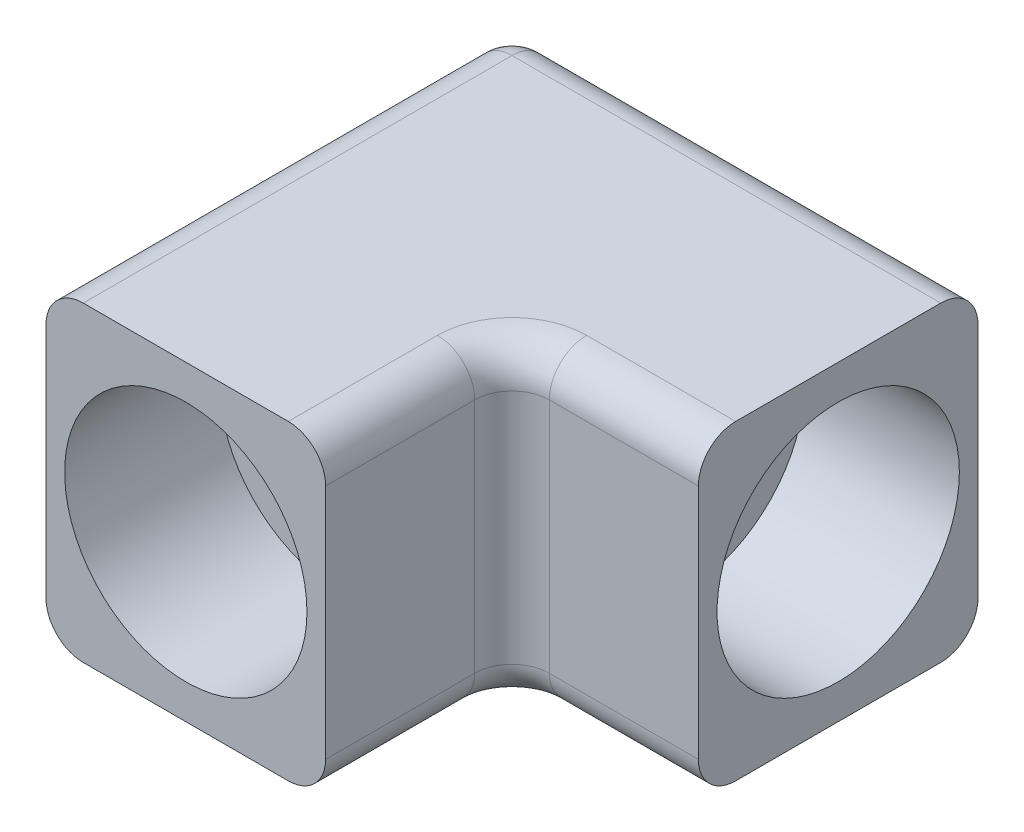
from build123d import *

# Parameters (mm, degrees)
SKETCH1_W           = 15
SKETCH1_H           = 10
SKETCH1_H_2         = 15
SKETCH1_W_2         = 10
BOSS_EXTRUDE1_DEPTH = 16.7
SKETCH2_R           = 6.5
CUT_EXTRUDE1_DEPTH  = 8.3
SKETCH3_R           = 6.5
CUT_EXTRUDE2_DEPTH  = 8.3
SKETCH4_R           = 6.5
CUT_EXTRUDE3_DEPTH  = 14.7
FILLET8_R           = 2


with BuildPart() as part:
    # Sketch1 → Boss-Extrude1 (new body)
    with BuildSketch(Plane(origin=(0, 0, 0), x_dir=(1, 0, 0), z_dir=(0, 1, 0))):
        Rectangle(SKETCH1_W, SKETCH1_H)
        with Locations((0, 12.5)):
            Rectangle(SKETCH1_W, SKETCH1_H_2)
        with Locations((12.5, 12.5)):
            Rectangle(SKETCH1_W_2, SKETCH1_H_2)
    extrude(amount=BOSS_EXTRUDE1_DEPTH)

    # Sketch2 → Cut-Extrude1 (cut)
    with BuildSketch(Plane.XY.offset(5)):
        with Locations((0, 8.35)):
            Circle(SKETCH2_R)
    extrude(amount=-CUT_EXTRUDE1_DEPTH, mode=Mode.SUBTRACT)

    # Sketch3 → Cut-Extrude2 (cut)
    with BuildSketch(Plane(origin=(17.5, 0, 0), x_dir=(0, 0, -1), z_dir=(1, 0, 0))):
        with Locations((12.5, 8.35)):
            Circle(SKETCH3_R)
    extrude(amount=-CUT_EXTRUDE2_DEPTH, mode=Mode.SUBTRACT)

    # Sketch4 → Cut-Extrude3 (cut)
    with BuildSketch(Plane.XZ):
        with Locations(Location((0, -12.5, 0), (0, 0, 270))):
            Circle(SKETCH4_R)
    extrude(amount=-CUT_EXTRUDE3_DEPTH, mode=Mode.SUBTRACT)

    # Fillet8
    # the kernel refuses this fillet: 2 mm, written as the material it adds along each edge
    with BuildSketch(Plane(origin=(7.5, 0, -5), x_dir=(0, 0, 1), z_dir=(0, 1, 0))) as fillet8_piece_1:
        with BuildLine():
            CenterArc((FILLET8_R, FILLET8_R), FILLET8_R, 180, 90)
            Line((0, FILLET8_R), (0, 0))
            Line((0, 0), (FILLET8_R, 0))
        make_face()
    extrude(amount=16.7)
    # the kernel refuses this fillet: 2 mm, written as the material it takes off along each edge
    with BuildSketch(Plane(origin=(-5.5, 2, -18), x_dir=(0, 0, -1), z_dir=(-1, 0, 0))) as fillet8_2_piece_1_section:
        Polygon((0, 0), (FILLET8_R, 0), (FILLET8_R, FILLET8_R), (0, FILLET8_R), align=None)
    fillet8_2_piece_1 = extrude(amount=FILLET8_R, mode=Mode.PRIVATE)
    fillet8_2_piece_1 = fillet8_2_piece_1 - Plane(origin=(-5.5, 2, -18), x_dir=(0, 0.7071067811865475, 0.7071067811865475), z_dir=(-1, 0, 0)) * Sphere(FILLET8_R, mode=Mode.PRIVATE)
    add(fillet8_2_piece_1, mode=Mode.SUBTRACT)
    with BuildSketch(Plane(origin=(-5.5, 14.7, -18), x_dir=(0, 1, 0), z_dir=(-1, 0, 0))) as fillet8_2_piece_2_section:
        Polygon((0, 0), (FILLET8_R, 0), (FILLET8_R, FILLET8_R), (0, FILLET8_R), align=None)
    fillet8_2_piece_2 = extrude(amount=FILLET8_R, mode=Mode.PRIVATE)
    fillet8_2_piece_2 = fillet8_2_piece_2 - Plane(origin=(-5.5, 14.7, -18), x_dir=(0, -0.7071067811865475, 0.7071067811865475), z_dir=(-1, 0, 0)) * Sphere(FILLET8_R, mode=Mode.PRIVATE)
    add(fillet8_2_piece_2, mode=Mode.SUBTRACT)
    with BuildSketch(Plane(origin=(-7.5, 0, -18), x_dir=(0, 1, 0), z_dir=(0, 0, 1)), Plane(origin=(22.5, 16.7, -20), x_dir=(0, 0, 1), z_dir=(-1, 0, 0)), Plane(origin=(-7.5, 16.7, 10), x_dir=(0, -1, 0), z_dir=(0, 0, -1)), Plane(origin=(22.5, 0, -20), x_dir=(0, 1, 0), z_dir=(-1, 0, 0))) as fillet8_2_piece_3:
        with BuildLine():
            CenterArc((FILLET8_R, -FILLET8_R), FILLET8_R, 90, 90)
            Line((0, -FILLET8_R), (0, 0))
            Line((0, 0), (FILLET8_R, 0))
        make_face()
    extrude(amount=28, mode=Mode.SUBTRACT)
    with BuildSketch(Plane(origin=(-7.5, 2, -20), x_dir=(0, 0, 1), z_dir=(0, 1, 0))) as fillet8_2_piece_4:
        with BuildLine():
            CenterArc((FILLET8_R, FILLET8_R), FILLET8_R, 180, 90)
            Line((0, FILLET8_R), (0, 0))
            Line((0, 0), (FILLET8_R, 0))
        make_face()
    extrude(amount=12.7, mode=Mode.SUBTRACT)
    # the kernel refuses this fillet: 2 mm, written as the material it takes off along each edge
    with BuildSketch(Plane(origin=(7.5, 16.7, 10), x_dir=(-1, 0, 0), z_dir=(0, 0, -1)), Plane(origin=(9.5, 16.7, -5), x_dir=(0, 0, -1), z_dir=(1, 0, 0)), Plane(origin=(7.5, 0, -3), x_dir=(-1, 0, 0), z_dir=(0, 0, 1))) as fillet8_3_piece_1:
        with BuildLine():
            CenterArc((FILLET8_R, -FILLET8_R), FILLET8_R, 90, 90)
            Line((0, -FILLET8_R), (0, 0))
            Line((0, 0), (FILLET8_R, 0))
        make_face()
    extrude(amount=13, mode=Mode.SUBTRACT)
    with BuildSketch(Plane(origin=(9.5, 0, -5), x_dir=(0, 0, -1), z_dir=(1, 0, 0))) as fillet8_3_piece_2:
        with BuildLine():
            CenterArc((FILLET8_R, FILLET8_R), FILLET8_R, 180, 90)
            Line((0, FILLET8_R), (0, 0))
            Line((0, 0), (FILLET8_R, 0))
        make_face()
    extrude(amount=13, mode=Mode.SUBTRACT)
    with BuildSketch(Plane(origin=(9.5, 0, -3), x_dir=(-1, 0, 0), z_dir=(0, 0, 1))) as fillet8_3_piece_3:
        with BuildLine():
            CenterArc((2 + FILLET8_R, -FILLET8_R), FILLET8_R, 90, 90)
            Line((2, -FILLET8_R), (2, 0))
            Line((2, 0), (2 + FILLET8_R, 0))
        make_face()
    revolve(axis=Axis((9.5, 0, -3), (0, -1, 0)), revolution_arc=90, mode=Mode.SUBTRACT)
    with BuildSketch(Plane(origin=(9.5, 16.7, -3), x_dir=(-1, 0, 0), z_dir=(0, 0, 1))) as fillet8_3_piece_4:
        with BuildLine():
            CenterArc((2 + FILLET8_R, FILLET8_R), FILLET8_R, 180, 90)
            Line((2, FILLET8_R), (2, 0))
            Line((2, 0), (2 + FILLET8_R, 0))
        make_face()
    revolve(axis=Axis((9.5, 16.7, -3), (0, -1, 0)), revolution_arc=90, mode=Mode.SUBTRACT)


solid = part.part
